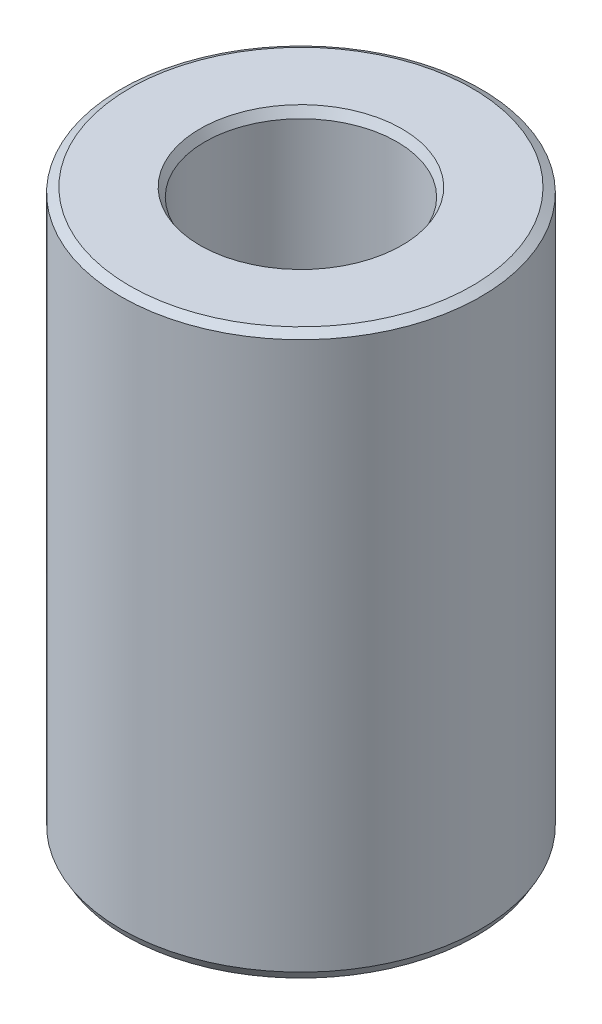
from build123d import *
from OCP.BRepFilletAPI import BRepFilletAPI_MakeChamfer

# Parameters (mm, degrees)
SKETCH1_R           = 32.5
BOSS_EXTRUDE1_DEPTH = 101.430636283
SKETCH2_R           = 17.337773689
CUT_EXTRUDE1_DEPTH  = 112.35831346
CHAMFER1_SIZE       = 0.907410761
CHAMFER1_SIZE2      = 1.571681541


with BuildPart() as part:
    # Sketch1 → Boss-Extrude1 (new body)
    with BuildSketch(Plane(origin=(0, 0, 0), x_dir=(1, 0, 0), z_dir=(0, 1, 0))):
        Circle(SKETCH1_R)
    extrude(amount=BOSS_EXTRUDE1_DEPTH)

    # Sketch2 → Cut-Extrude1 (cut, through all)
    with BuildSketch(Plane(origin=(0, 0, 0), x_dir=(1, 0, 0), z_dir=(0, 1, 0))):
        Circle(SKETCH2_R)
    extrude(amount=CUT_EXTRUDE1_DEPTH, mode=Mode.SUBTRACT)

    # Chamfer1: one chamfer whose edges measure the first distance from different faces: ONE call of the kernel's chamfer builder (chamfer() names one face for all edges)
    chamfer1_edges_1 = [part.edges().sort_by_distance(p)[0] for p in [
        (-17.337773689, 101.430636283, 0),
    ]]
    chamfer1_side_1 = [part.faces().sort_by_distance(p)[0] for p in [
        (-31.580761184, 101.430636283, 0),
    ]]
    chamfer1_edges_2 = [part.edges().sort_by_distance(p)[0] for p in [
        (-17.337773689, 0, 0),
    ]]
    chamfer1_side_2 = [part.faces().sort_by_distance(p)[0] for p in [
        (-17.337773689, 50.715318141, 0),
    ]]
    chamfer1_edges_3 = [part.edges().sort_by_distance(p)[0] for p in [
        (-32.5, 0, 0),
    ]]
    chamfer1_side_3 = [part.faces().sort_by_distance(p)[0] for p in [
        (-31.580761184, 0, 0),
    ]]
    chamfer1_edges_4 = [part.edges().sort_by_distance(p)[0] for p in [
        (-32.5, 101.430636283, 0),
    ]]
    chamfer1_side_4 = [part.faces().sort_by_distance(p)[0] for p in [
        (-32.5, 50.715318141, 0),
    ]]
    chamfer1 = BRepFilletAPI_MakeChamfer(part.part.solid().wrapped)
    for e in chamfer1_edges_1:
        chamfer1.Add(CHAMFER1_SIZE, CHAMFER1_SIZE2, e.wrapped, chamfer1_side_1[0].wrapped)  # the first distance lies on this face
    for e in chamfer1_edges_2:
        chamfer1.Add(CHAMFER1_SIZE, CHAMFER1_SIZE2, e.wrapped, chamfer1_side_2[0].wrapped)  # the first distance lies on this face
    for e in chamfer1_edges_3:
        chamfer1.Add(CHAMFER1_SIZE, CHAMFER1_SIZE2, e.wrapped, chamfer1_side_3[0].wrapped)  # the first distance lies on this face
    for e in chamfer1_edges_4:
        chamfer1.Add(CHAMFER1_SIZE, CHAMFER1_SIZE2, e.wrapped, chamfer1_side_4[0].wrapped)  # the first distance lies on this face
    add(Compound.cast(chamfer1.Shape()), mode=Mode.REPLACE)


solid = part.part
